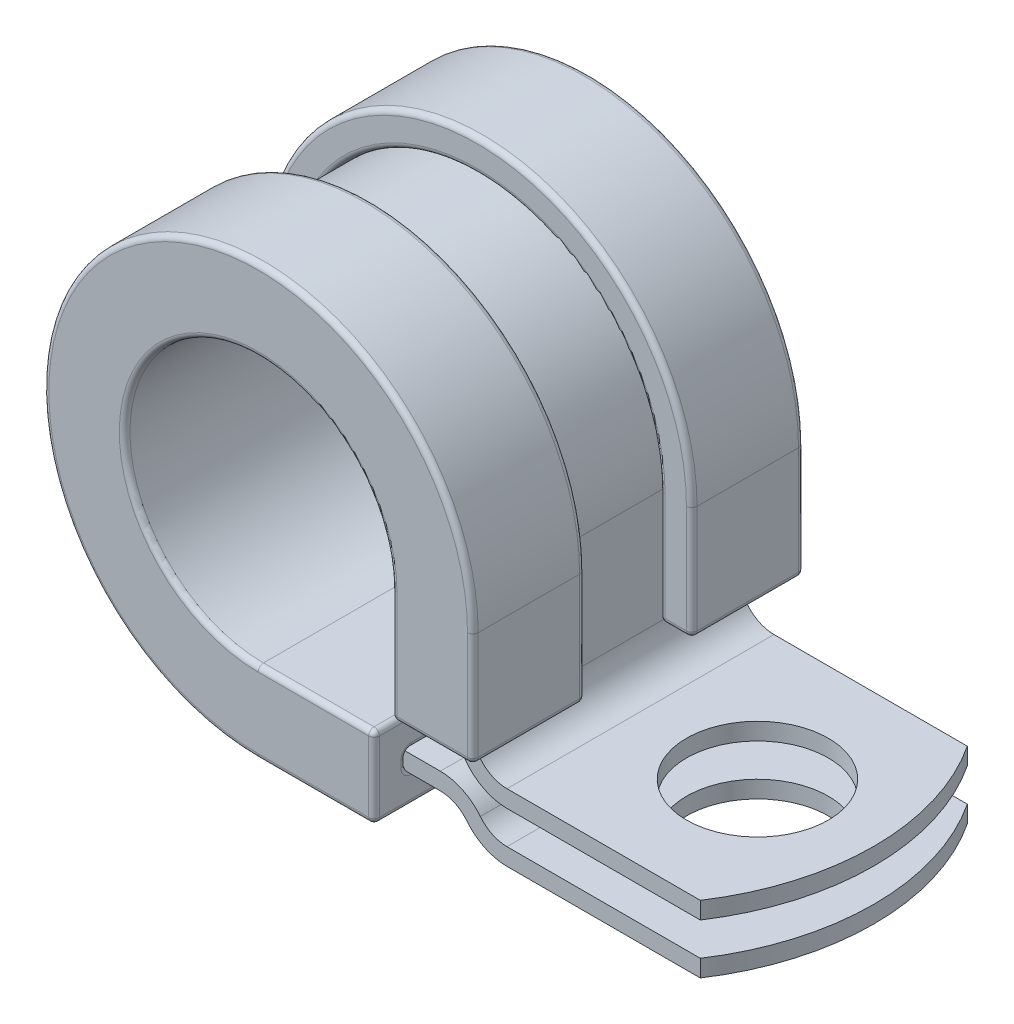
from build123d import *

# Parameters (mm, degrees)
BOSS_EXTRUDE1_DEPTH         = 6.35
SKETCH2_R                   = 3.3734375
CUT_EXTRUDE1_DEPTH          = 25.55738678
CUT_EXTRUDE3_DEPTH          = 25.55738678
CUT_EXTRUDE3_DEPTH_BACK     = 25.55738678
BOSS_EXTRUDE2_DEPTH         = 7.874
BOSS_EXTRUDE2_DEPTH_BACK    = 7.874
BODY_MOVE_COPY1_START       = -5.3848
BODY_MOVE_COPY1_OUTLINE_W   = 0.8128
BODY_MOVE_COPY1_OUTLINE_H   = 12.7
BODY_MOVE_COPY1_DEPTH       = 5.3848
BODY_MOVE_COPY1_START_2     = -8.7884
BODY_MOVE_COPY1_2_OUTLINE_W = 0.8128
BODY_MOVE_COPY1_2_OUTLINE_H = 12.7
BODY_MOVE_COPY1_2_DEPTH     = 0.1016
BODY_MOVE_COPY1_START_3     = -7.8232
BODY_MOVE_COPY1_3_OUTLINE_R = 3.3734375
BODY_MOVE_COPY1_3_DEPTH     = 2.4384
BODY_MOVE_COPY1_START_4     = -10.2108
BODY_MOVE_COPY1_4_OUTLINE_R = 3.3734375
BODY_MOVE_COPY1_4_DEPTH     = 2.3368
BODY_MOVE_COPY1_5_OUTLINE_W = 0.8128
BODY_MOVE_COPY1_5_OUTLINE_H = 12.7
BODY_MOVE_COPY1_5_DEPTH     = 7.874
BODY_MOVE_COPY1_START_5     = -6.35
BODY_MOVE_COPY1_6_DEPTH     = 12.7
BODY_MOVE_COPY1_7_DEPTH     = 12.7
CUT_EXTRUDE4_DEPTH          = 2.54
CUT_EXTRUDE4_DEPTH_BACK     = 2.54
FILLET1_R                   = 0.254


with BuildPart() as part:
    # Sketch1 → Boss-Extrude1 (new, symmetric)
    with BuildSketch(Plane.XY):
        with BuildLine():
            Line((0, -7.874), (7.139941017, -7.874))
            ThreePointArc((7.139941017, -7.874), (8.195799189, -8.114455942), (9.043416407, -8.7884))
            ThreePointArc((9.043416407, -8.7884), (9.608494552, -9.237696038), (10.3124, -9.398))
            Line((10.3124, -9.398), (21.4122, -9.398))
            Line((21.4122, -9.398), (21.4122, -10.2108))
            Line((21.4122, -10.2108), (10.3124, -10.2108))
            ThreePointArc((10.3124, -10.2108), (9.256541828, -9.970344058), (8.40892461, -9.2964))
            ThreePointArc((8.40892461, -9.2964), (7.843846465, -8.847103962), (7.139941017, -8.6868))
            Line((7.139941017, -8.6868), (0, -8.6868))
            ThreePointArc((0, -8.6868), (-6.142495187, 6.142495187), (8.6868, 0))
            Line((8.6868, 0), (8.6868, -5.3848))
            ThreePointArc((8.6868, -5.3848), (9.162927217, -6.534272783), (10.3124, -7.0104))
            Line((10.3124, -7.0104), (21.4122, -7.0104))
            Line((21.4122, -7.0104), (21.4122, -7.8232))
            Line((21.4122, -7.8232), (10.3124, -7.8232))
            ThreePointArc((10.3124, -7.8232), (8.588190825, -7.109009175), (7.874, -5.3848))
            Line((7.874, -5.3848), (7.874, 0))
            ThreePointArc((7.874, 0), (-5.567758795, 5.567758795), (0, -7.874))
        make_face()
    extrude(amount=BOSS_EXTRUDE1_DEPTH, both=True)

    # Sketch2 → Cut-Extrude1 (cut, through all)
    with BuildSketch(Plane(origin=(0, 0, 0), x_dir=(1, 0, 0), z_dir=(0, 1, 0))):
        with Locations(Location((15.875, 0, 0), (0, 0, 270))):
            Circle(SKETCH2_R)
    extrude(amount=-CUT_EXTRUDE1_DEPTH, mode=Mode.SUBTRACT)

    # Sketch4 → Cut-Extrude3 (cut, two sides: drawn at the far end of the back side and taken through both)
    with BuildSketch(Plane(origin=(0, 0, 0), x_dir=(1, 0, 0), z_dir=(0, 1, 0)).offset(-CUT_EXTRUDE3_DEPTH_BACK)):
        with BuildLine():
            Line((-20.04033962, 66.33043509), (19.5072, 6.35))
            ThreePointArc((19.5072, 6.35), (21.4122, 0), (19.5072, -6.35))
            Line((19.5072, -6.35), (-20.04033962, -66.33043509))
            Line((-20.04033962, -66.33043509), (123.649054332, -66.33043509))
            Line((123.649054332, -66.33043509), (123.649054332, 66.33043509))
            Line((123.649054332, 66.33043509), (-20.04033962, 66.33043509))
        make_face()
    extrude(amount=CUT_EXTRUDE3_DEPTH + CUT_EXTRUDE3_DEPTH_BACK, mode=Mode.SUBTRACT)


with BuildPart() as body_2:
    # Sketch5 → Boss-Extrude2 (new, two sides: drawn at the far end of the back side and taken through both)
    with BuildSketch(Plane.XY.offset(-BOSS_EXTRUDE2_DEPTH_BACK)):
        with BuildLine():
            Line((6.35, 0), (6.35, -5.3848))
            Line((6.35, -5.3848), (10.2108, -5.3848))
            Line((10.2108, -5.3848), (10.2108, 0))
            ThreePointArc((10.2108, 0), (-7.220125921, 7.220125921), (0, -10.2108))
            Line((0, -10.2108), (5.514341017, -10.2108))
            Line((5.514341017, -10.2108), (5.514341017, -6.35))
            Line((5.514341017, -6.35), (0, -6.35))
            ThreePointArc((0, -6.35), (-4.490128061, 4.490128061), (6.35, 0))
        make_face()
    extrude(amount=BOSS_EXTRUDE2_DEPTH + BOSS_EXTRUDE2_DEPTH_BACK)


with BuildPart() as body_3:
    # Body-Move/Copy1: read off the stored shape, not the designer's step
    # Body-Move/Copy1 outline → Body-Move/Copy1 (new body)
    with BuildSketch(Plane(origin=(0, 0, 0), x_dir=(1, 0, 0), z_dir=(0, 1, 0)).offset(BODY_MOVE_COPY1_START)):
        with Locations((8.2804, 0)):
            Rectangle(BODY_MOVE_COPY1_OUTLINE_W, BODY_MOVE_COPY1_OUTLINE_H)
    extrude(amount=BODY_MOVE_COPY1_DEPTH)

    # Body-Move_Copy1 2 outline → Body-Move_Copy1 2 (add)
    with BuildSketch(Plane(origin=(0, 0, 0), x_dir=(1, 0, 0), z_dir=(0, 1, 0)).offset(BODY_MOVE_COPY1_START_2)):
        with Locations((8.2804, 0)):
            Rectangle(BODY_MOVE_COPY1_2_OUTLINE_W, BODY_MOVE_COPY1_2_OUTLINE_H)
    extrude(amount=BODY_MOVE_COPY1_2_DEPTH)

    # Body-Move_Copy1 3 outline → Body-Move_Copy1 3 (add)
    with BuildSketch(Plane(origin=(0, 0, 0), x_dir=(1, 0, 0), z_dir=(0, 1, 0)).offset(BODY_MOVE_COPY1_START_3)):
        with BuildLine():
            ThreePointArc((19.5072, -6.35), (21.4122, 0), (19.5072, 6.35))
            Line((19.5072, 6.35), (7.874, 6.35))
            Line((7.874, 6.35), (7.874, -6.35))
            Line((7.874, -6.35), (19.5072, -6.35))
        make_face()
        with Locations((15.875, 0)):
            Circle(BODY_MOVE_COPY1_3_OUTLINE_R, mode=Mode.SUBTRACT)
    extrude(amount=BODY_MOVE_COPY1_3_DEPTH)

    # Body-Move_Copy1 4 outline → Body-Move_Copy1 4 (add)
    with BuildSketch(Plane(origin=(0, 0, 0), x_dir=(1, 0, 0), z_dir=(0, 1, 0)).offset(BODY_MOVE_COPY1_START_4)):
        with BuildLine():
            ThreePointArc((19.5072, -6.35), (21.4122, 0), (19.5072, 6.35))
            Line((19.5072, 6.35), (7.874, 6.35))
            Line((7.874, 6.35), (7.874, -6.35))
            Line((7.874, -6.35), (19.5072, -6.35))
        make_face()
        with Locations((15.875, 0)):
            Circle(BODY_MOVE_COPY1_4_OUTLINE_R, mode=Mode.SUBTRACT)
    extrude(amount=BODY_MOVE_COPY1_4_DEPTH)

    # Body-Move_Copy1 5 outline → Body-Move_Copy1 5 (add)
    with BuildSketch(Plane(origin=(0, 0, 0), x_dir=(1, 0, 0), z_dir=(0, 1, 0))):
        with Locations((8.2804, 0)):
            Rectangle(BODY_MOVE_COPY1_5_OUTLINE_W, BODY_MOVE_COPY1_5_OUTLINE_H)
    extrude(amount=BODY_MOVE_COPY1_5_DEPTH)

    # Body-Move_Copy1 6 outline → Body-Move_Copy1 6 (cut)
    with BuildSketch(Plane.XY.offset(BODY_MOVE_COPY1_START_5)):
        with BuildLine():
            ThreePointArc((8.6868, -5.3848), (9.162927217, -6.534272783), (10.3124, -7.0104))
            Line((10.3124, -7.0104), (23, -7.0104))
            Line((23, -7.0104), (23, -5.3848))
            Line((23, -5.3848), (8.6868, -5.3848))
        make_face()
        with BuildLine():
            ThreePointArc((7.873999999, 3.668871525), (8.481166118, 1.87891339), (8.6868, 0))
            Line((8.6868, 0), (8.6868, 7.874))
            Line((8.6868, 7.874), (7.874, 7.874))
            Line((7.874, 7.874), (7.873999999, 3.668871525))
        make_face()
        with BuildLine():
            Line((7.874, -7.8232), (10.3124, -7.8232))
            ThreePointArc((10.3124, -7.8232), (8.588190825, -7.109009175), (7.874, -5.3848))
            Line((7.874, -5.3848), (7.874, -7.8232))
        make_face()
        with BuildLine():
            Line((23, -9.398), (23, -7.874))
            Line((23, -7.874), (7.874, -7.874))
            Line((7.874, -7.874), (7.874, -7.987114647))
            ThreePointArc((7.874, -7.987114647), (8.51822308, -8.300899785), (9.043416407, -8.7884))
            ThreePointArc((9.043416407, -8.7884), (9.608494552, -9.237696038), (10.3124, -9.398))
            Line((10.3124, -9.398), (23, -9.398))
        make_face()
        with BuildLine():
            ThreePointArc((8.40892461, -9.2964), (8.164746446, -9.050516807), (7.874, -8.86197497))
            Line((7.874, -8.86197497), (7.874, -10.2108))
            Line((7.874, -10.2108), (10.3124, -10.2108))
            ThreePointArc((10.3124, -10.2108), (9.256541828, -9.970344058), (8.40892461, -9.2964))
        make_face()
    extrude(amount=BODY_MOVE_COPY1_6_DEPTH, mode=Mode.SUBTRACT)

    # Body-Move_Copy1 7 outline → Body-Move_Copy1 7 (add)
    with BuildSketch(Plane.XY.offset(BODY_MOVE_COPY1_START_5)):
        with BuildLine():
            Line((7.874, 0), (7.873999999, 3.668871525))
            ThreePointArc((7.873999999, 3.668871525), (-7.325682474, 4.668497675), (0, -8.6868))
            Line((0, -8.6868), (7.139941017, -8.6868))
            ThreePointArc((7.139941017, -8.6868), (7.517276697, -8.731200094), (7.874, -8.86197497))
            Line((7.874, -8.86197497), (7.874, -7.987114647))
            ThreePointArc((7.874, -7.987114647), (7.511302537, -7.902444568), (7.139941017, -7.874))
            Line((7.139941017, -7.874), (0, -7.874))
            ThreePointArc((0, -7.874), (-5.567758795, 5.567758795), (7.874, 0))
        make_face()
    extrude(amount=BODY_MOVE_COPY1_7_DEPTH)


with BuildPart() as body_2_1:
    add(body_2.part)

    # Combine1: cut body 3
    add(body_3.part, mode=Mode.SUBTRACT)

    # Sketch7 → Cut-Extrude4 (cut, two sides: drawn at the far end of the back side and taken through both)
    with BuildSketch(Plane.XY.offset(-CUT_EXTRUDE4_DEPTH_BACK)):
        with BuildLine():
            Line((7.874, 0), (7.874, -5.3848))
            Line((7.874, -5.3848), (10.2108, -5.3848))
            Line((10.2108, -5.3848), (10.2108, 0))
            ThreePointArc((10.2108, 0), (-7.220125921, 7.220125921), (0, -10.2108))
            Line((0, -10.2108), (5.514341017, -10.2108))
            Line((5.514341017, -10.2108), (5.514341017, -7.874))
            Line((5.514341017, -7.874), (0, -7.874))
            ThreePointArc((0, -7.874), (-5.567758795, 5.567758795), (7.874, 0))
        make_face()
    extrude(amount=CUT_EXTRUDE4_DEPTH + CUT_EXTRUDE4_DEPTH_BACK, mode=Mode.SUBTRACT)

    # Fillet1
    fillet1_edges = [body_2_1.edges().sort_by_distance(p)[0] for p in [
        (8.6868, -5.3848, -4.445),
        (5.514341017, -8.6868, -4.445),
        (10.2108, -5.3848, -5.207),
        (5.514341017, -10.2108, -5.207),
        (2.757170508, -8.6868, -2.54),
        (-7.325682474, 4.668497676, -2.54),
        (8.6868, -2.6924, -2.54),
        (5.514341017, -9.4488, -2.54),
        (5.514341017, -9.4488, 2.54),
        (2.757170508, -10.2108, 2.54),
        (2.757170508, -10.2108, -2.54),
        (-7.220125921, 7.220125921, 2.54),
        (-7.220125921, 7.220125921, -2.54),
        (10.2108, -2.6924, 2.54),
        (10.2108, -2.6924, -2.54),
        (9.4488, -5.3848, 2.54),
        (9.4488, -5.3848, -2.54),
        (2.757170508, -8.6868, 2.54),
        (-7.325682474, 4.668497676, 2.54),
        (8.6868, -2.6924, 2.54),
        (5.514341017, -6.35, 0),
        (2.757170508, -6.35, 7.874),
        (5.514341017, -10.2108, 5.207),
        (10.2108, -5.3848, 5.207),
        (6.35, -5.3848, 0),
        (5.514341017, -8.2804, 7.874),
        (2.757170508, -10.2108, 7.874),
        (-7.220125921, 7.220125921, 7.874),
        (10.2108, -2.6924, 7.874),
        (8.2804, -5.3848, 7.874),
        (6.35, -2.6924, 7.874),
        (-4.490128061, 4.490128061, 7.874),
        (6.35, -2.6924, -7.874),
        (8.2804, -5.3848, -7.874),
        (10.2108, -2.6924, -7.874),
        (-7.220125921, 7.220125921, -7.874),
        (2.757170508, -10.2108, -7.874),
        (5.514341017, -8.2804, -7.874),
        (2.757170508, -6.35, -7.874),
        (-4.490128061, 4.490128061, -7.874),
        (8.2804, -5.3848, -6.35),
        (8.2804, -5.3848, 6.35),
        (5.514341017, -7.874, 0),
        (5.514341017, -8.6868, 4.445),
        (2.757170508, -8.6868, -6.35),
        (2.757170508, -7.874, -6.35),
        (2.757170508, -7.874, 6.35),
        (-5.567758795, 5.567758795, 6.35),
        (7.874, -2.6924, 6.35),
        (8.6868, -2.6924, 6.35),
        (-7.325682474, 4.668497676, 6.35),
        (2.757170508, -8.6868, 6.35),
        (5.514341017, -8.2804, 6.35),
        (5.514341017, -8.2804, -6.35),
        (7.874, -5.3848, 0),
        (8.6868, -2.6924, -6.35),
        (8.6868, -5.3848, 4.445),
        (-7.325682474, 4.668497676, -6.35),
        (-5.567758795, 5.567758795, -6.35),
        (7.874, -2.6924, -6.35),
    ]]
    fillet(fillet1_edges, radius=FILLET1_R)


solid = Compound([part.part, body_2_1.part])
